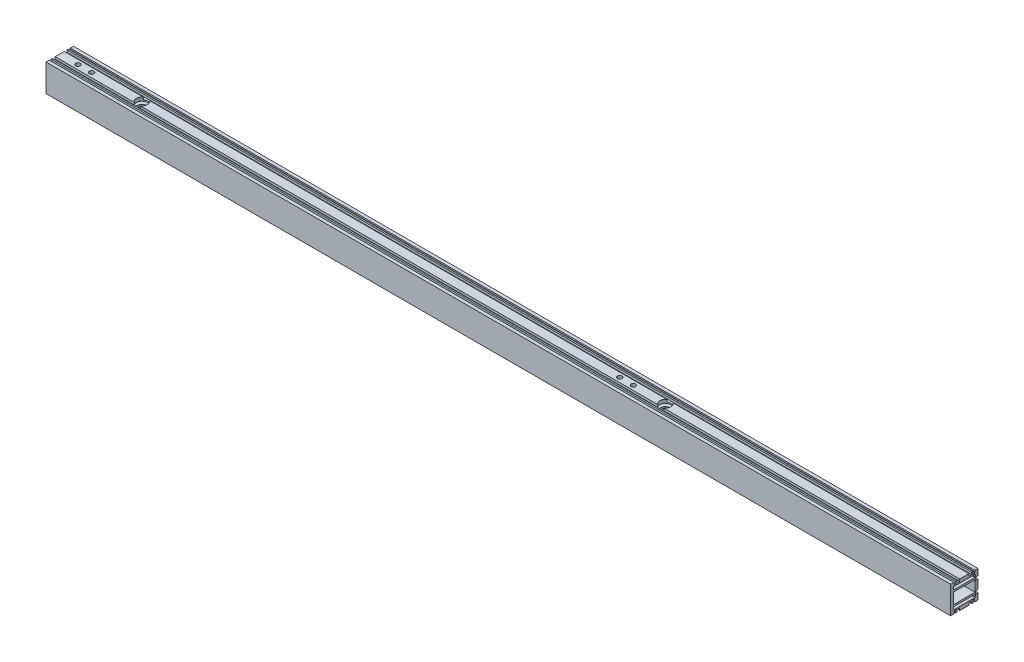
from build123d import *

# Parameters (mm, degrees)
SKETCH_1_W              = 23.5
SKETCH_1_H              = 12
EXTRUDE_1_DEPTH         = 495.5
HOLE_WIZARD_M6_1_D      = 5
HOLE_WIZARD_M6_1_DEPTH  = 19
HOLE_WIZARD_M6_1_TIP    = 1.502151548
HOLE_WIZARD_M6_2_D      = 5
HOLE_WIZARD_M6_2_DEPTH  = 19
HOLE_WIZARD_M6_2_TIP    = 1.502151548
HOLE_WIZARD_M6_3_D      = 5
HOLE_WIZARD_M6_3_DEPTH  = 19
HOLE_WIZARD_M6_3_TIP    = 1.502151548
HOLE_WIZARD_12_0_12_1_D = 12
HOLE_WIZARD_M4_1_D      = 3.3
HOLE_WIZARD_M4_1_DEPTH  = 11.5
HOLE_WIZARD_M4_1_TIP    = 0.991420021


with BuildPart() as part:
    # 草图1 → 凸台-拉伸1 (new, symmetric)
    with BuildSketch(Plane(origin=(0, 0, 0), x_dir=(0, 0, -1), z_dir=(1, 0, 0))):
        Polygon((-11.5, 15), (-15, 15), (-15, -15), (-11.5, -15), (-11.5, -13.5), (-11, -13.5), (-11, -12), (-9.5, -12), (-9.5, -15), (-8, -15), (-8, -12.5), (-5, -12.5), (-5, -15), (5, -15), (5, -12.5), (8, -12.5), (8, -15), (9.5, -15), (9.5, -12), (11, -12), (11, -13.5), (11.5, -13.5), (11.5, -15), (15, -15), (15, -8), (12.5, -8), (12.5, -5), (15, -5), (15, 5), (12.5, 5), (12.5, 8), (15, 8), (15, 15), (11.5, 15), (11.5, 13.5), (11, 13.5), (11, 12), (9.5, 12), (9.5, 15), (8, 15), (8, 12.5), (5, 12.5), (5, 15), (-5, 15), (-5, 12.5), (-8, 12.5), (-8, 15), (-9.5, 15), (-9.5, 12), (-11, 12), (-11, 13.5), (-11.5, 13.5), align=None)
        with BuildLine():
            Line((12, -8.5), (12, -10.5))
            ThreePointArc((12, -10.5), (11.853553391, -10.853553391), (11.5, -11))
            Line((11.5, -11), (-11.5, -11))
            ThreePointArc((-11.5, -11), (-11.853553391, -10.853553391), (-12, -10.5))
            Line((-12, -10.5), (-12, -8.5))
            ThreePointArc((-12, -8.5), (-11.853553391, -8.146446609), (-11.5, -8))
            Line((-11.5, -8), (11.5, -8))
            ThreePointArc((11.5, -8), (11.853553391, -8.146446609), (12, -8.5))
        make_face(mode=Mode.SUBTRACT)
        Rectangle(SKETCH_1_W, SKETCH_1_H, mode=Mode.SUBTRACT)
        with BuildLine():
            ThreePointArc((-12, 10.5), (-11.853553391, 10.853553391), (-11.5, 11))
            Line((-11.5, 11), (11.5, 11))
            ThreePointArc((11.5, 11), (11.853553391, 10.853553391), (12, 10.5))
            Line((12, 10.5), (12, 8.5))
            ThreePointArc((12, 8.5), (11.853553391, 8.146446609), (11.5, 8))
            Line((11.5, 8), (-11.5, 8))
            ThreePointArc((-11.5, 8), (-11.853553391, 8.146446609), (-12, 8.5))
            Line((-12, 8.5), (-12, 10.5))
        make_face(mode=Mode.SUBTRACT)
    extrude(amount=EXTRUDE_1_DEPTH, both=True)

    # M6 螺纹孔1
    with Locations(Plane(origin=(0, -15, 0), x_dir=(-1, 0, 0), z_dir=(0, -1, 0))):
        with Locations((-445.5, 0), (-430.5, 0), (230.5, 0), (245.5, 0), (460.5, 0), (475.5, 0)):
            Hole(HOLE_WIZARD_M6_1_D / 2, depth=HOLE_WIZARD_M6_1_DEPTH)
            with Locations((0, 0, -(HOLE_WIZARD_M6_1_DEPTH + HOLE_WIZARD_M6_1_TIP / 2))):  # 118° drill point
                Cone(0, HOLE_WIZARD_M6_1_D / 2, HOLE_WIZARD_M6_1_TIP, mode=Mode.SUBTRACT)

    # M6 螺纹孔2
    with Locations(Plane(origin=(0, 0, -15), x_dir=(-1, 0, 0), z_dir=(0, 0, -1))):
        with Locations((-445.5, 0), (-430.5, 0), (-370.5, 0), (-266.5, 0), (-394.5, 0)):
            Hole(HOLE_WIZARD_M6_2_D / 2, depth=HOLE_WIZARD_M6_2_DEPTH)
            with Locations((0, 0, -(HOLE_WIZARD_M6_2_DEPTH + HOLE_WIZARD_M6_2_TIP / 2))):  # 118° drill point
                Cone(0, HOLE_WIZARD_M6_2_D / 2, HOLE_WIZARD_M6_2_TIP, mode=Mode.SUBTRACT)

    # M6 螺纹孔3
    with Locations(Plane(origin=(0, 15, 0), x_dir=(1, 0, 0), z_dir=(0, 1, 0))):
        with Locations((133, 0), (118, 0), (-460.5, 0), (-475.5, 0)):
            Hole(HOLE_WIZARD_M6_3_D / 2, depth=HOLE_WIZARD_M6_3_DEPTH)
            with Locations((0, 0, -(HOLE_WIZARD_M6_3_DEPTH + HOLE_WIZARD_M6_3_TIP / 2))):  # 118° drill point
                Cone(0, HOLE_WIZARD_M6_3_D / 2, HOLE_WIZARD_M6_3_TIP, mode=Mode.SUBTRACT)

    # Ø12.0 (12) 直径孔1 (through all)
    with Locations(Plane(origin=(0, -15, 0), x_dir=(-1, 0, 0), z_dir=(0, -1, 0))):
        with Locations((-168, 0), (405.5, 0)):
            Hole(HOLE_WIZARD_12_0_12_1_D / 2)

    # M4 螺纹孔1
    with Locations(Plane(origin=(0, 0, -15), x_dir=(-1, 0, 0), z_dir=(0, 0, -1))):
        with Locations((-341, 0), (-296, 0), (-236, 0), (-191, 0)):
            Hole(HOLE_WIZARD_M4_1_D / 2, depth=HOLE_WIZARD_M4_1_DEPTH)
            with Locations((0, 0, -(HOLE_WIZARD_M4_1_DEPTH + HOLE_WIZARD_M4_1_TIP / 2))):  # 118° drill point
                Cone(0, HOLE_WIZARD_M4_1_D / 2, HOLE_WIZARD_M4_1_TIP, mode=Mode.SUBTRACT)


solid = part.part
